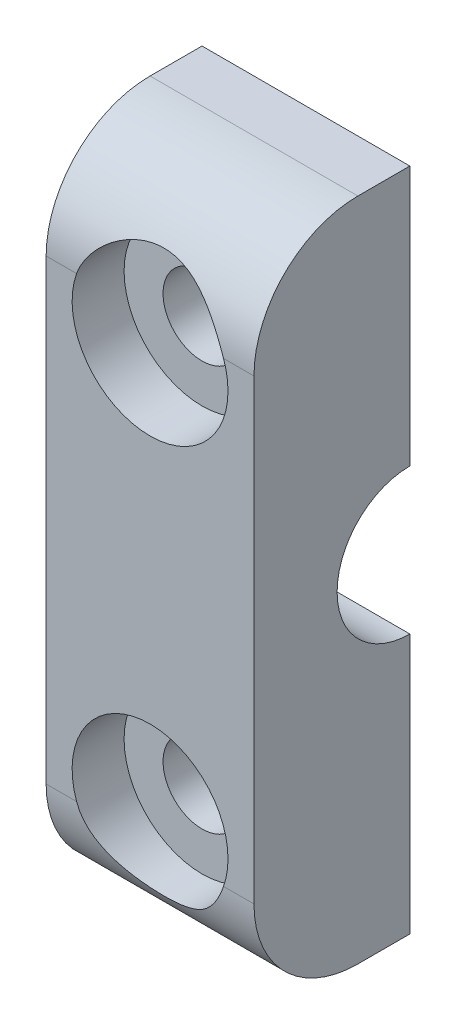
from build123d import *

# Parameters (mm, degrees)
CROQUIS1_W              = 8
CROQUIS1_H              = 25.6
CROQUIS1_R              = 1.5
SALIENTE_EXTRUIR1_DEPTH = 6
REDONDEO1_R             = 4
CROQUIS2_R              = 3
CORTAR_EXTRUIR1_DEPTH   = 2
CROQUIS3_R              = 2.8
CORTAR_EXTRUIR2_DEPTH   = 8


with BuildPart() as part:
    # Croquis1 → Saliente-Extruir1 (new body)
    with BuildSketch(Plane.XY):
        with Locations((-128.440920984, 53.999185999)):
            Rectangle(CROQUIS1_W, CROQUIS1_H)
        with Locations((-128.440920984, 61.799185999)):
            Circle(CROQUIS1_R, mode=Mode.SUBTRACT)
        with Locations((-128.440920984, 46.199185999)):
            Circle(CROQUIS1_R, mode=Mode.SUBTRACT)
    extrude(amount=SALIENTE_EXTRUIR1_DEPTH)

    # Redondeo1
    # the kernel refuses this fillet: 4 mm, written as the material it takes off along each edge
    with BuildSketch(Plane(origin=(-142.440920984, 66.799185999, 6), x_dir=(0, 0, -1), z_dir=(1, 0, 0)), Plane(origin=(-114.440920984, 41.199185999, 6), x_dir=(0, 0, -1), z_dir=(-1, 0, 0))) as redondeo1_piece_1:
        with BuildLine():
            CenterArc((REDONDEO1_R, -REDONDEO1_R), REDONDEO1_R, 90, 90)
            Line((0, -REDONDEO1_R), (0, 0))
            Line((0, 0), (REDONDEO1_R, 0))
        make_face()
    extrude(amount=28, mode=Mode.SUBTRACT)

    # Croquis2 → Cortar-Extruir1 (cut)
    with BuildSketch(Plane.XY.offset(6)):
        with Locations((-128.440920984, 46.199185999)):
            Circle(CROQUIS2_R)
        with Locations((-128.440920984, 61.799185999)):
            Circle(CROQUIS2_R)
    extrude(amount=-CORTAR_EXTRUIR1_DEPTH, mode=Mode.SUBTRACT)

    # Croquis3 → Cortar-Extruir2 (cut)
    with BuildSketch(Plane(origin=(-124.440920984, 0, 0), x_dir=(0, 0, -1), z_dir=(1, 0, 0))):
        with Locations((0, 53.999185999)):
            Circle(CROQUIS3_R)
    extrude(amount=-CORTAR_EXTRUIR2_DEPTH, mode=Mode.SUBTRACT)


solid = part.part
